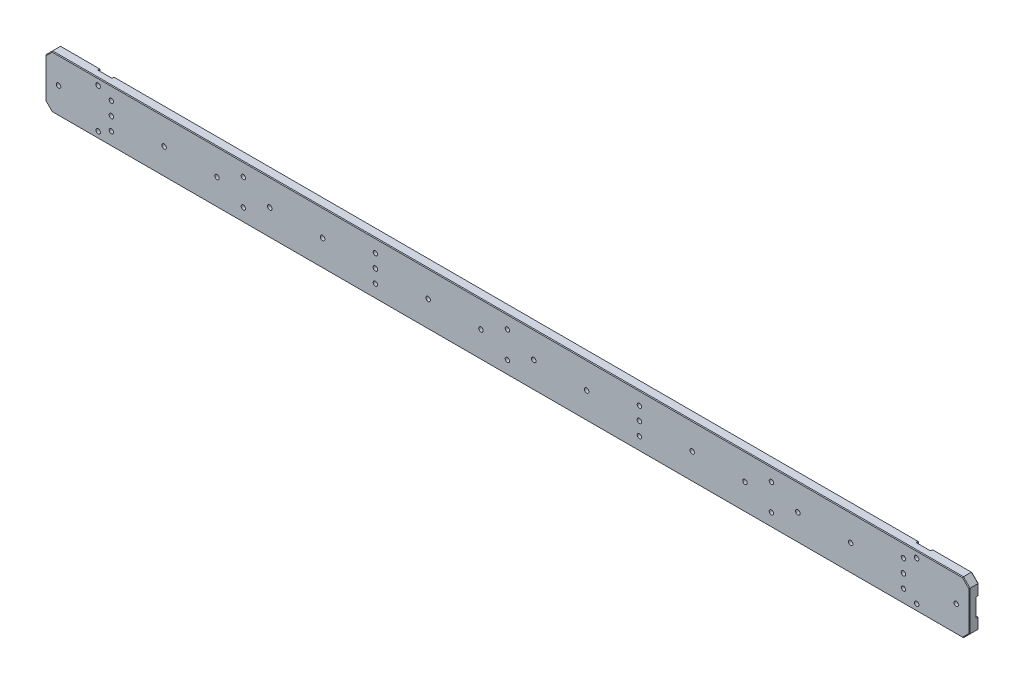
from build123d import *

# Parameters (mm, degrees)
SKETCH_1_W                 = 1400
SKETCH_1_H                 = 80
EXTRUDE_1_DEPTH            = 14
SKETCH_2_W                 = 1500
SKETCH_2_H                 = 28
CUT_EXTRUDE_1_DEPTH        = 4
HOLE_WIZARD_1_D            = 6.6
HOLE_WIZARD_1_CBORE_D      = 11
HOLE_WIZARD_1_CBORE_DEPTH  = 8
PATTERN_LINEAR_1_COUNT     = 4
PATTERN_LINEAR_1_PITCH     = 200
PATTERN_LINEAR_1_COL_COUNT = 4
PATTERN_LINEAR_1_COL_PITCH = 200
HOLE_WIZARD_M8_1_D         = 6.8
PATTERN_LINEAR_2_COUNT     = 18
PATTERN_LINEAR_2_PITCH     = 80
CHAMFER_1_SIZE             = 10
CHAMFER_2_SIZE             = 1
SKETCH_9_W                 = 20
SKETCH_9_H                 = 6
CUT_EXTRUDE_2_DEPTH        = 705.695678999
HOLE_WIZARD_M8_2_D         = 6.8
CHAMFER_3_SIZE             = 1


# Some blends are built 0.0001 mm under size
with BuildPart() as part:
    # 草图1 → 凸台-拉伸1 (new body)
    with BuildSketch(Plane.XY):
        Rectangle(SKETCH_1_W, SKETCH_1_H)
    extrude(amount=EXTRUDE_1_DEPTH)

    # 草图2 → 切除-拉伸1 (cut)
    with BuildSketch(Plane(origin=(0, 0, 0), x_dir=(-1, 0, 0), z_dir=(0, 0, -1))):
        Rectangle(SKETCH_2_W, SKETCH_2_H)
    extrude(amount=-CUT_EXTRUDE_1_DEPTH, mode=Mode.SUBTRACT)

    # 打孔尺寸(%根据)内六角圆柱头螺钉的类型1 (through all)
    with Locations(Plane(origin=(0, 0, 0), x_dir=(-1, 0, 0), z_dir=(0, 0, -1))):
        with Locations((0, -20), (0, 20)):
            hole_wizard_1 = CounterBoreHole(HOLE_WIZARD_1_D / 2, HOLE_WIZARD_1_CBORE_D / 2, HOLE_WIZARD_1_CBORE_DEPTH)

    # 阵列(线性)1: 打孔尺寸(%根据)内六角圆柱头螺钉的类型1 ×4
    with Locations(*[(i * PATTERN_LINEAR_1_PITCH, 0, 0) for i in range(1, PATTERN_LINEAR_1_COUNT)]):
        add(hole_wizard_1, mode=Mode.SUBTRACT)

    # 阵列(线性)1 col: 打孔尺寸(%根据)内六角圆柱头螺钉的类型1 ×4
    with Locations(*[(-i * PATTERN_LINEAR_1_COL_PITCH, 0, 0) for i in range(1, PATTERN_LINEAR_1_COL_COUNT)]):
        add(hole_wizard_1, mode=Mode.SUBTRACT)

    # M8 螺纹孔1 (through all)
    with Locations(Plane(origin=(0, 0, 4), x_dir=(-1, 0, 0), z_dir=(0, 0, -1))):
        with Locations((-680, 0)):
            hole_wizard_m8_1 = Hole(HOLE_WIZARD_M8_1_D / 2)

    # 阵列(线性)2: M8 螺纹孔1 ×18
    with Locations(*[(-i * PATTERN_LINEAR_2_PITCH, 0, 0) for i in range(1, PATTERN_LINEAR_2_COUNT)]):
        add(hole_wizard_m8_1, mode=Mode.SUBTRACT)

    # 倒角1
    chamfer_1_edges = [part.edges().sort_by_distance(p)[0] for p in [
        (700, -40, 7),
        (-700, -40, 7),
        (-700, 40, 7),
        (700, 40, 7),
    ]]
    chamfer(chamfer_1_edges, length=CHAMFER_1_SIZE)

    # 倒角2
    # the kernel refuses this chamfer: 1 mm, written as the material it takes off along each edge
    with BuildSketch(Plane(origin=(700, 32.571682988, 0), x_dir=(-0.9996219169112968, 0, -0.027495876610586483), z_dir=(0, -1, 0)), Plane(origin=(-700, 11.428317012, 0), x_dir=(0.9996219169112968, 0, -0.027495876610586483), z_dir=(0, 1, 0))) as chamfer_2_piece_1:
        Polygon((CHAMFER_2_SIZE * 0.999621916911, -CHAMFER_2_SIZE * 0.0274958766106), (-CHAMFER_2_SIZE * 0.0274958766106, -CHAMFER_2_SIZE * 0.999621916911), (0, 0), align=None)
    extrude(amount=21.143365976, mode=Mode.SUBTRACT)
    with BuildSketch(Plane(origin=(-700, -32.571682988, 0), x_dir=(-0.027495876610582174, 0, 0.9996219169112968), z_dir=(0, 1, 0)), Plane(origin=(700, -11.428317012, 0), x_dir=(0.027495876610582174, 0, 0.9996219169112968), z_dir=(0, -1, 0))) as chamfer_2_piece_2:
        Polygon((CHAMFER_2_SIZE * 0.999621916911, CHAMFER_2_SIZE * 0.0274958766106), (-CHAMFER_2_SIZE * 0.0274958766106, CHAMFER_2_SIZE * 0.999621916911), (0, 0), align=None)
    extrude(amount=21.143365976, mode=Mode.SUBTRACT)
    with BuildSketch(Plane(origin=(-702.571682988, -14, 0), x_dir=(0, -0.9996219169112968, -0.02749587661058639), z_dir=(1, 0, 0)), Plane(origin=(702.571682988, 14, 0), x_dir=(0, 0.9996219169112968, -0.02749587661058639), z_dir=(-1, 0, 0))) as chamfer_2_piece_3:
        Polygon((CHAMFER_2_SIZE * 0.999621916911, -CHAMFER_2_SIZE * 0.0274958766106), (-CHAMFER_2_SIZE * 0.0274958766106, -CHAMFER_2_SIZE * 0.999621916911), (0, 0), align=None)
    extrude(amount=1405.143365976, mode=Mode.SUBTRACT)
    with BuildSketch(Plane(origin=(692.571682988, -40, 0), x_dir=(0, -0.02749587661058908, 0.9996219169112968), z_dir=(-1, 0, 0)), Plane(origin=(692.571682988, -40, 14), x_dir=(0, 0.9996219169112968, 0.02749587661058555), z_dir=(-1, 0, 0)), Plane(origin=(-692.571682988, 40, 0), x_dir=(0, 0.02749587661058908, 0.9996219169112968), z_dir=(1, 0, 0))) as chamfer_2_piece_4:
        Polygon((CHAMFER_2_SIZE * 0.999621916911, CHAMFER_2_SIZE * 0.0274958766106), (-CHAMFER_2_SIZE * 0.0274958766106, CHAMFER_2_SIZE * 0.999621916911), (0, 0), align=None)
    extrude(amount=1385.143365976, mode=Mode.SUBTRACT)
    with BuildSketch(Plane(origin=(701.81845448, -28.18154552, 0), x_dir=(0.01944252080600517, -0.01944252080600517, 0.9996219169112972), z_dir=(-0.7071067811865476, -0.7071067811865476, 0)), Plane(origin=(701.81845448, -28.18154552, 14), x_dir=(-0.7068394360706735, 0.7068394360706735, 0.027495876610585897), z_dir=(-0.7071067811865476, -0.7071067811865476, 0)), Plane(origin=(-688.18154552, 41.81845448, 14), x_dir=(-0.019442520805986165, 0.019442520805986165, -0.9996219169112978), z_dir=(-0.7071067811865476, -0.7071067811865476, 0)), Plane(origin=(-688.18154552, 41.81845448, 0), x_dir=(0.7068394360706736, -0.7068394360706736, -0.02749587661058688), z_dir=(-0.7071067811865476, -0.7071067811865476, 0))) as chamfer_2_piece_5:
        Polygon((CHAMFER_2_SIZE * 0.999621916911, CHAMFER_2_SIZE * 0.0274958766106), (-CHAMFER_2_SIZE * 0.0274958766106, CHAMFER_2_SIZE * 0.999621916911), (0, 0), align=None)
    extrude(amount=19.2855016, mode=Mode.SUBTRACT)
    with BuildSketch(Plane(origin=(-701.81845448, -28.18154552, 0), x_dir=(-0.01944252080600517, -0.01944252080600517, 0.9996219169112972), z_dir=(0.7071067811865476, -0.7071067811865476, 0)), Plane(origin=(688.18154552, 41.81845448, 14), x_dir=(0.019442520805986165, 0.019442520805986165, -0.9996219169112978), z_dir=(0.7071067811865476, -0.7071067811865476, 0)), Plane(origin=(-701.81845448, -28.18154552, 14), x_dir=(0.7068394360706735, 0.7068394360706735, 0.027495876610585897), z_dir=(0.7071067811865476, -0.7071067811865476, 0)), Plane(origin=(688.18154552, 41.81845448, 0), x_dir=(-0.7068394360706736, -0.7068394360706736, -0.02749587661058688), z_dir=(0.7071067811865476, -0.7071067811865476, 0))) as chamfer_2_piece_6:
        Polygon((CHAMFER_2_SIZE * 0.999621916911, -CHAMFER_2_SIZE * 0.0274958766106), (-CHAMFER_2_SIZE * 0.0274958766106, -CHAMFER_2_SIZE * 0.999621916911), (0, 0), align=None)
    extrude(amount=19.2855016, mode=Mode.SUBTRACT)
    with BuildSketch(Plane(origin=(-700, -32.571682988, 14), x_dir=(0.9996219169112968, 0, 0.02749587661058574), z_dir=(0, 1, 0)), Plane(origin=(700, 32.571682988, 14), x_dir=(-0.9996219169112968, 0, 0.02749587661058574), z_dir=(0, -1, 0))) as chamfer_2_piece_7:
        Polygon((CHAMFER_2_SIZE * 0.999621916911, CHAMFER_2_SIZE * 0.0274958766106), (-CHAMFER_2_SIZE * 0.0274958766106, CHAMFER_2_SIZE * 0.999621916911), (0, 0), align=None)
    extrude(amount=65.143365976, mode=Mode.SUBTRACT)
    with BuildSketch(Plane(origin=(-692.571682988, 40, 14), x_dir=(0, 0.0274958766105891, -0.9996219169112968), z_dir=(1, 0, 0))) as chamfer_2_piece_8:
        Polygon((CHAMFER_2_SIZE * 0.999621916911, -CHAMFER_2_SIZE * 0.0274958766106), (-CHAMFER_2_SIZE * 0.0274958766106, -CHAMFER_2_SIZE * 0.999621916911), (0, 0), align=None)
    extrude(amount=1385.143365976, mode=Mode.SUBTRACT)

    # 草图9 → 切除-拉伸2 (cut, through all)
    with BuildSketch(Plane.XZ.offset(40)):
        with Locations((-620, 0)):
            Rectangle(SKETCH_9_W, SKETCH_9_H)
    cut_extrude_2 = extrude(amount=-CUT_EXTRUDE_2_DEPTH, mode=Mode.SUBTRACT)

    # M8 螺纹孔2 (through all)
    with Locations(Plane(origin=(0, 0, 3), x_dir=(-1, 0, 0), z_dir=(0, 0, -1))):
        with Locations((620, -30), (620, 30)):
            hole_wizard_m8_2 = Hole(HOLE_WIZARD_M8_2_D / 2)

    # 镜向1: 切除-拉伸2, M8 螺纹孔2 across plane
    add(cut_extrude_2.mirror(Plane(origin=(0, 0, 0), x_dir=(0, 0, 1), z_dir=(1, 0, 0))), mode=Mode.SUBTRACT)
    add(hole_wizard_m8_2.mirror(Plane(origin=(0, 0, 0), x_dir=(0, 0, 1), z_dir=(1, 0, 0))), mode=Mode.SUBTRACT)

    # 倒角3
    chamfer_3_edges = [part.edges().sort_by_distance(p)[0] for p in [
        (-610, 39.5, 0.5),
        (-630, 39.5, 0.5),
        (-620, -14, 3),
        (-620, 14, 3),
        (-620, 40, 3),
        (-630, -14, 2),
        (-630, -27, 0),
        (-630, 14, 2),
        (-630, 40, 2),
        (-630, 27, 0),
        (-610, -14, 2),
        (-610, -27, 0),
        (-610, 14, 2),
        (-610, 27, 0),
        (-610, 40, 2),
        (-630, 14.5, 0.5),
        (-630, -39.5, 0.5),
        (-630, -14.5, 0.5),
        (-610, -14.5, 0.5),
        (-610, -39.5, 0.5),
        (-610, 14.5, 0.5),
        (-610, -40, 2),
        (-620, -40, 3),
        (-630, -40, 2),
        (610, 39.5, 0.5),
        (630, 39.5, 0.5),
        (620, -14, 3),
        (620, -40, 3),
        (630, -40, 2),
        (630, -39.5, 0.5),
        (630, -14.5, 0.5),
        (630, 14.5, 0.5),
        (610, -14.5, 0.5),
        (610, -39.5, 0.5),
        (610, -40, 2),
        (610, 14.5, 0.5),
        (630, -14, 2),
        (630, -27, 0),
        (630, 27, 0),
        (630, 14, 2),
        (610, -14, 2),
        (610, 14, 2),
        (610, 27, 0),
        (610, -27, 0),
        (620, 14, 3),
        (630, 40, 2),
        (610, 40, 2),
        (620, 40, 3),
    ]]
    chamfer(chamfer_3_edges, length=CHAMFER_3_SIZE - 0.0001)  # a hair under: the kernel refuses the full size


solid = part.part
